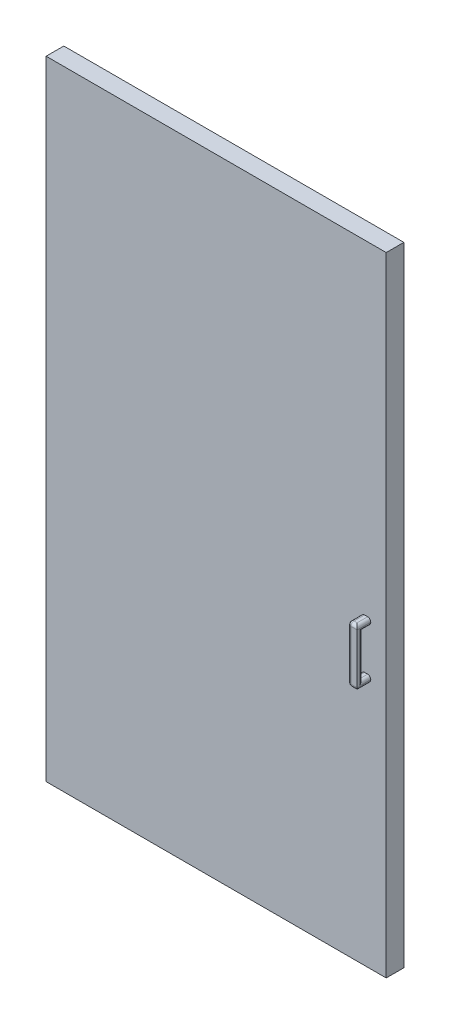
from build123d import *

# Parameters (mm, degrees)
BOSS_EXTRUDE2_DEPTH = 57.15
BOSS_EXTRUDE3_DEPTH = 44
CUT_EXTRUDE1_DEPTH  = 44
FILLET1_R           = 10
BOSS_EXTRUDE4_DEPTH = 10


with BuildPart() as part:
    # Sketch1 → Boss-Extrude2 (new body)
    with BuildSketch(Plane.XY):
        Polygon((0, 0), (0, 446.2018372120283), (-1100, 446.2018372120282), (-1100, -1585.7981627879717), (0, -1585.7981627879717), align=None)
    extrude(amount=BOSS_EXTRUDE2_DEPTH)

    # Sketch4 → Boss-Extrude3 (add)
    with BuildSketch(Plane.XY.offset(57.15)):
        Polygon((-79.99999999999993, -603.7981627879718), (-49.999999999999936, -603.7981627879718), (-49.999999999999915, -785.7981627879718), (-79.9999999999999, -785.7981627879718), align=None)
    extrude(amount=BOSS_EXTRUDE3_DEPTH)

    # Sketch5 → Cut-Extrude1 (cut)
    with BuildSketch(Plane.ZY.offset(80.00000000000003)):
        Polygon((83.14999999999999, -624.7981627879717), (57.150000000000006, -624.7981627879717), (57.15, -764.7981627879717), (83.15, -764.7981627879717), align=None)
    extrude(amount=-CUT_EXTRUDE1_DEPTH, mode=Mode.SUBTRACT)

    # Fillet1
    # the kernel refuses this fillet: 10 mm, written as the material it takes off along each edge
    with BuildSketch(Plane(origin=(-69.99999999999993, -613.7981627879718, 91.15), x_dir=(-1, -1.6e-16, 0), z_dir=(0, 1, 0))) as fillet1_piece_1_section:
        Polygon((0, 0), (FILLET1_R, 0), (FILLET1_R, FILLET1_R), (0, FILLET1_R), align=None)
    fillet1_piece_1 = extrude(amount=FILLET1_R, mode=Mode.PRIVATE)
    fillet1_piece_1 = fillet1_piece_1 - Plane(origin=(-69.99999999999993, -613.7981627879718, 91.15), x_dir=(0.7071067811865475, 0, -0.7071067811865475), z_dir=(0, 1, 0)) * Sphere(FILLET1_R, mode=Mode.PRIVATE)
    add(fillet1_piece_1, mode=Mode.SUBTRACT)
    with BuildSketch(Plane(origin=(-69.9999999999999, -775.7981627879718, 91.15), x_dir=(0, 0, 1), z_dir=(-1, -1.6e-16, 0))) as fillet1_piece_2_section:
        Polygon((0, 0), (FILLET1_R, 0), (FILLET1_R, -FILLET1_R), (0, -FILLET1_R), align=None)
    fillet1_piece_2 = extrude(amount=FILLET1_R, mode=Mode.PRIVATE)
    fillet1_piece_2 = fillet1_piece_2 - Plane(origin=(-69.9999999999999, -775.7981627879718, 91.15), x_dir=(0, 0.7071067811865475, -0.7071067811865475), z_dir=(-1, -1.6e-16, 0)) * Sphere(FILLET1_R, mode=Mode.PRIVATE)
    add(fillet1_piece_2, mode=Mode.SUBTRACT)
    with BuildSketch(Plane(origin=(-49.999999999999915, -785.7981627879718, 57.15), x_dir=(-1, 0, 0), z_dir=(0, 0, 1))) as fillet1_piece_3:
        with BuildLine():
            CenterArc((FILLET1_R, -FILLET1_R), FILLET1_R, 90, 90)
            Line((0, -FILLET1_R), (0, 0))
            Line((0, 0), (FILLET1_R, 0))
        make_face()
    extrude(amount=69, mode=Mode.SUBTRACT)
    with BuildSketch(Plane(origin=(-49.999999999999936, -603.7981627879718, 57.15), x_dir=(0, -1, 0), z_dir=(0, 0, 1))) as fillet1_piece_4:
        with BuildLine():
            CenterArc((FILLET1_R, -FILLET1_R), FILLET1_R, 90, 90)
            Line((0, -FILLET1_R), (0, 0))
            Line((0, 0), (FILLET1_R, 0))
        make_face()
    extrude(amount=69, mode=Mode.SUBTRACT)
    with BuildSketch(Plane(origin=(-79.99999999999993, -603.7981627879718, 57.15), x_dir=(1, 0, 0), z_dir=(0, 0, 1))) as fillet1_piece_5:
        with BuildLine():
            CenterArc((FILLET1_R, -FILLET1_R), FILLET1_R, 90, 90)
            Line((0, -FILLET1_R), (0, 0))
            Line((0, 0), (FILLET1_R, 0))
        make_face()
    extrude(amount=34.00000000000001, mode=Mode.SUBTRACT)
    with BuildSketch(Plane(origin=(-79.9999999999999, -785.7981627879718, 57.15), x_dir=(1, 0, 0), z_dir=(0, 0, 1))) as fillet1_piece_6:
        with BuildLine():
            CenterArc((FILLET1_R, FILLET1_R), FILLET1_R, 180, 90)
            Line((0, FILLET1_R), (0, 0))
            Line((0, 0), (FILLET1_R, 0))
        make_face()
    extrude(amount=34.00000000000001, mode=Mode.SUBTRACT)
    with BuildSketch(Plane(origin=(-69.99999999999993, -603.7981627879718, 101.15), x_dir=(0, 0, -1), z_dir=(1, 0, 0))) as fillet1_piece_7:
        with BuildLine():
            CenterArc((FILLET1_R, -FILLET1_R), FILLET1_R, 90, 90)
            Line((0, -FILLET1_R), (0, 0))
            Line((0, 0), (FILLET1_R, 0))
        make_face()
    extrude(amount=44.99999999999999, mode=Mode.SUBTRACT)
    with BuildSketch(Plane(origin=(-79.9999999999999, -775.7981627879718, 101.15), x_dir=(0, 0, -1), z_dir=(-1.6e-16, 1, 0))) as fillet1_piece_8:
        with BuildLine():
            CenterArc((FILLET1_R, -FILLET1_R), FILLET1_R, 90, 90)
            Line((0, -FILLET1_R), (0, 0))
            Line((0, 0), (FILLET1_R, 0))
        make_face()
    extrude(amount=162, mode=Mode.SUBTRACT)
    with BuildSketch(Plane(origin=(-24.999999999999915, -785.7981627879718, 101.15), x_dir=(0, 0, -1), z_dir=(-1, 0, 0))) as fillet1_piece_9:
        with BuildLine():
            CenterArc((FILLET1_R, -FILLET1_R), FILLET1_R, 90, 90)
            Line((0, -FILLET1_R), (0, 0))
            Line((0, 0), (FILLET1_R, 0))
        make_face()
    extrude(amount=44.999999999999986, mode=Mode.SUBTRACT)
    with BuildSketch(Plane(origin=(-79.99999999999991, -764.7981627879717, 57.15000000000002), x_dir=(1.42e-15, -1, 0), z_dir=(0, 0, 1))) as fillet1_piece_10:
        with BuildLine():
            CenterArc((FILLET1_R, FILLET1_R), FILLET1_R, 180, 89.99999999999989)
            Line((1.421e-14, FILLET1_R), (0, 0))
            Line((0, 0), (FILLET1_R, 0))
        make_face()
    extrude(amount=25.999999999999986, mode=Mode.SUBTRACT)
    with BuildSketch(Plane(origin=(-79.99999999999993, -624.7981627879717, 83.14999999999999), x_dir=(0, 1, 0), z_dir=(0, 0, -1))) as fillet1_piece_11:
        with BuildLine():
            CenterArc((FILLET1_R, FILLET1_R), FILLET1_R, 180, 90)
            Line((0, FILLET1_R), (0, 0))
            Line((0, 0), (FILLET1_R, 0))
        make_face()
    extrude(amount=25.999999999999986, mode=Mode.SUBTRACT)
    with BuildSketch(Plane(origin=(-79.99999999999991, -764.7981627879717, 83.15), x_dir=(1.42e-15, 1e-16, 1), z_dir=(-1.5e-16, 1, -1e-16))) as fillet1_piece_12:
        with BuildLine():
            CenterArc((FILLET1_R, FILLET1_R), FILLET1_R, 180, 89.99999999999989)
            Line((1.421e-14, FILLET1_R), (0, 0))
            Line((0, 0), (FILLET1_R, 0))
        make_face()
    extrude(amount=140, mode=Mode.SUBTRACT)
    with BuildSketch(Plane(origin=(-49.999999999999915, -764.7981627879717, 83.15), x_dir=(0, -1, 0), z_dir=(0, 0, -1))) as fillet1_piece_13:
        with BuildLine():
            CenterArc((FILLET1_R, FILLET1_R), FILLET1_R, 180, 90)
            Line((0, FILLET1_R), (0, 0))
            Line((0, 0), (FILLET1_R, 0))
        make_face()
    extrude(amount=26, mode=Mode.SUBTRACT)
    with BuildSketch(Plane(origin=(-49.999999999999936, -624.7981627879717, 57.150000000000006), x_dir=(0, 1, 0), z_dir=(0, 0, 1))) as fillet1_piece_14:
        with BuildLine():
            CenterArc((FILLET1_R, FILLET1_R), FILLET1_R, 180.00000000000003, 90)
            Line((0, FILLET1_R), (0, 0))
            Line((0, 0), (FILLET1_R, 0))
        make_face()
    extrude(amount=25.999999999999986, mode=Mode.SUBTRACT)
    with BuildSketch(Plane(origin=(-49.999999999999936, -624.7981627879717, 83.15), x_dir=(0, 1e-16, 1), z_dir=(1.2e-16, -1, 1e-16))) as fillet1_piece_15:
        with BuildLine():
            CenterArc((FILLET1_R, FILLET1_R), FILLET1_R, 180, 90)
            Line((0, FILLET1_R), (0, 0))
            Line((0, 0), (FILLET1_R, 0))
        make_face()
    extrude(amount=140, mode=Mode.SUBTRACT)
    with BuildSketch(Plane(origin=(-79.99999999999991, -764.7981627879717, 57.15000000000002), x_dir=(1.42e-15, -1, 0), z_dir=(0, 0, 1))) as fillet1_piece_16a_section:
        with BuildLine():
            CenterArc((FILLET1_R, FILLET1_R), FILLET1_R, 180, 89.99999999999989)
            Line((1.421e-14, FILLET1_R), (0, 0))
            Line((0, 0), (FILLET1_R, 0))
        make_face()
    fillet1_piece_16a = extrude(amount=50.999999999999986, mode=Mode.PRIVATE)
    fillet1_piece_16a = split(fillet1_piece_16a, bisect_by=Plane(origin=(-77.7360488573316, -767.0621139306398, 83.15), z_dir=(0, 1e-16, 1)), keep=Keep.TOP, mode=Mode.PRIVATE)
    with BuildSketch(Plane(origin=(-79.9999999999999, -789.7981627879717, 83.15), x_dir=(0, 1e-16, 1), z_dir=(-1.5e-16, 1, -1e-16))) as fillet1_piece_16b_section:
        with BuildLine():
            CenterArc((FILLET1_R, FILLET1_R), FILLET1_R, 180, 90)
            Line((0, FILLET1_R), (0, 0))
            Line((0, 0), (FILLET1_R, 0))
        make_face()
    fillet1_piece_16b = extrude(amount=165, mode=Mode.PRIVATE)
    fillet1_piece_16b = split(fillet1_piece_16b, bisect_by=Plane(origin=(-77.73604885733165, -764.7981627879717, 85.41395114266827), z_dir=(1.5e-16, -1, 0)), keep=Keep.TOP, mode=Mode.PRIVATE)
    fillet1_piece_16 = fillet1_piece_16a & fillet1_piece_16b
    add(fillet1_piece_16, mode=Mode.SUBTRACT)
    with BuildSketch(Plane(origin=(-79.99999999999991, -764.7981627879717, 83.15), x_dir=(1.42e-15, 1e-16, 1), z_dir=(-1.5e-16, 1, -1e-16))) as fillet1_piece_17a_section:
        with BuildLine():
            CenterArc((FILLET1_R, FILLET1_R), FILLET1_R, 180, 89.99999999999989)
            Line((1.421e-14, FILLET1_R), (0, 0))
            Line((0, 0), (FILLET1_R, 0))
        make_face()
    fillet1_piece_17a = extrude(amount=165, mode=Mode.PRIVATE)
    fillet1_piece_17a = split(fillet1_piece_17a, bisect_by=Plane(origin=(-77.73604885733167, -624.7981627879717, 85.41395114266825), z_dir=(-1.5e-16, 1, 0)), keep=Keep.TOP, mode=Mode.PRIVATE)
    with BuildSketch(Plane(origin=(-79.99999999999993, -624.7981627879717, 108.14999999999998), x_dir=(0, 1, 0), z_dir=(0, 0, -1))) as fillet1_piece_17b_section:
        with BuildLine():
            CenterArc((FILLET1_R, FILLET1_R), FILLET1_R, 180, 90)
            Line((0, FILLET1_R), (0, 0))
            Line((0, 0), (FILLET1_R, 0))
        make_face()
    fillet1_piece_17b = extrude(amount=50.999999999999986, mode=Mode.PRIVATE)
    fillet1_piece_17b = split(fillet1_piece_17b, bisect_by=Plane(origin=(-77.73604885733164, -622.5342116453035, 83.14999999999999), z_dir=(0, 1e-16, 1)), keep=Keep.TOP, mode=Mode.PRIVATE)
    fillet1_piece_17 = fillet1_piece_17a & fillet1_piece_17b
    add(fillet1_piece_17, mode=Mode.SUBTRACT)
    with BuildSketch(Plane(origin=(-49.999999999999936, -624.7981627879717, 83.15), x_dir=(0, 1e-16, 1), z_dir=(1.2e-16, -1, 1e-16))) as fillet1_piece_18a_section:
        with BuildLine():
            CenterArc((FILLET1_R, FILLET1_R), FILLET1_R, 180, 90)
            Line((0, FILLET1_R), (0, 0))
            Line((0, 0), (FILLET1_R, 0))
        make_face()
    fillet1_piece_18a = extrude(amount=165, mode=Mode.PRIVATE)
    fillet1_piece_18a = split(fillet1_piece_18a, bisect_by=Plane(origin=(-52.26395114266817, -764.7981627879717, 85.41395114266827), z_dir=(1.5e-16, -1, 0)), keep=Keep.TOP, mode=Mode.PRIVATE)
    with BuildSketch(Plane(origin=(-49.999999999999915, -764.7981627879717, 108.15), x_dir=(0, -1, 0), z_dir=(0, 0, -1))) as fillet1_piece_18b_section:
        with BuildLine():
            CenterArc((FILLET1_R, FILLET1_R), FILLET1_R, 180, 90)
            Line((0, FILLET1_R), (0, 0))
            Line((0, 0), (FILLET1_R, 0))
        make_face()
    fillet1_piece_18b = extrude(amount=51, mode=Mode.PRIVATE)
    fillet1_piece_18b = split(fillet1_piece_18b, bisect_by=Plane(origin=(-52.2639511426682, -767.0621139306397, 83.15), z_dir=(0, 1e-16, 1)), keep=Keep.TOP, mode=Mode.PRIVATE)
    fillet1_piece_18 = fillet1_piece_18a & fillet1_piece_18b
    add(fillet1_piece_18, mode=Mode.SUBTRACT)
    with BuildSketch(Plane(origin=(-49.999999999999936, -624.7981627879717, 57.150000000000006), x_dir=(0, 1, 0), z_dir=(0, 0, 1))) as fillet1_piece_19a_section:
        with BuildLine():
            CenterArc((FILLET1_R, FILLET1_R), FILLET1_R, 180.00000000000003, 90)
            Line((0, FILLET1_R), (0, 0))
            Line((0, 0), (FILLET1_R, 0))
        make_face()
    fillet1_piece_19a = extrude(amount=50.999999999999986, mode=Mode.PRIVATE)
    fillet1_piece_19a = split(fillet1_piece_19a, bisect_by=Plane(origin=(-52.26395114266823, -622.5342116453035, 83.14999999999999), z_dir=(0, 1e-16, 1)), keep=Keep.TOP, mode=Mode.PRIVATE)
    with BuildSketch(Plane(origin=(-49.999999999999936, -599.7981627879717, 83.14999999999999), x_dir=(0, 1e-16, 1), z_dir=(1.2e-16, -1, 1e-16))) as fillet1_piece_19b_section:
        with BuildLine():
            CenterArc((FILLET1_R, FILLET1_R), FILLET1_R, 179.99999999999997, 90)
            Line((0, FILLET1_R), (0, 0))
            Line((0, 0), (FILLET1_R, 0))
        make_face()
    fillet1_piece_19b = extrude(amount=165, mode=Mode.PRIVATE)
    fillet1_piece_19b = split(fillet1_piece_19b, bisect_by=Plane(origin=(-52.26395114266818, -624.7981627879717, 85.41395114266824), z_dir=(-1.5e-16, 1, 0)), keep=Keep.TOP, mode=Mode.PRIVATE)
    fillet1_piece_19 = fillet1_piece_19a & fillet1_piece_19b
    add(fillet1_piece_19, mode=Mode.SUBTRACT)

    # Sketch6 → Boss-Extrude4 (add)
    with BuildSketch(Plane(origin=(0, 0, 0), x_dir=(-1, 0, 0), z_dir=(0, 0, -1))):
        Polygon((34.99999999999994, -272.04870051020725), (164.99999999999986, -272.04870051020725), (165, -812.0487005102073), (35, -812.0487005102073), align=None)
    extrude(amount=BOSS_EXTRUDE4_DEPTH)


solid = part.part
